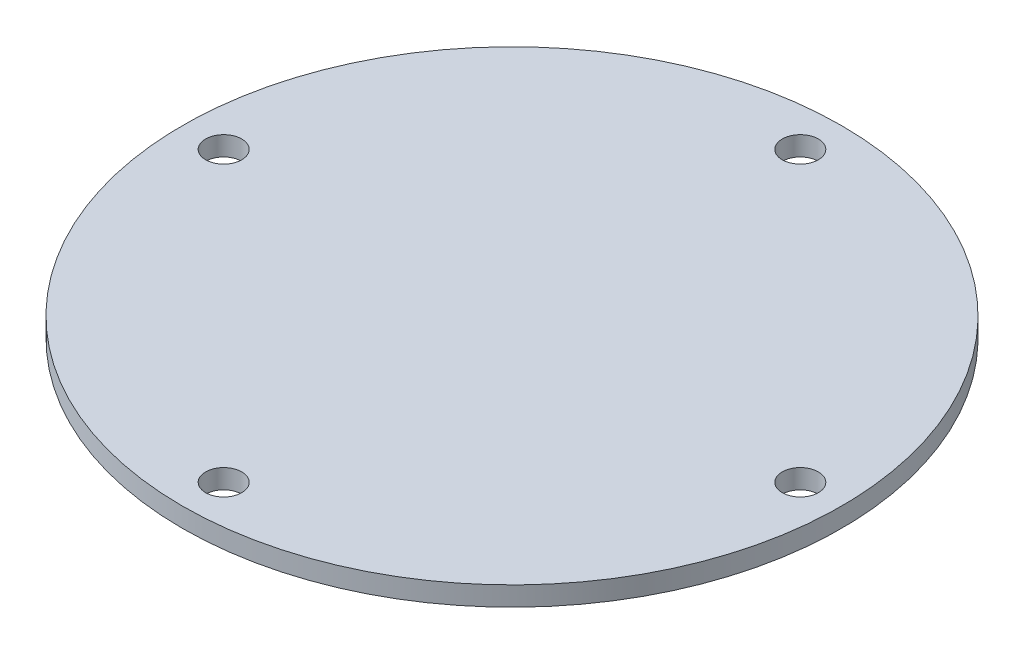
from build123d import *

# Parameters (mm, degrees)
SKETCH1_R            = 63.9
BOSS_EXTRUDE1_DEPTH  = 3.75
M6_CLEARANCE_HOLE1_D = 7
CIRPATTERN1_COUNT    = 4


with BuildPart() as part:
    # Sketch1 → Boss-Extrude1 (new body)
    with BuildSketch(Plane(origin=(0, 0, 0), x_dir=(1, 0, 0), z_dir=(0, 1, 0))):
        Circle(SKETCH1_R)
    extrude(amount=BOSS_EXTRUDE1_DEPTH)

    # M6 Clearance Hole1 (through all)
    with Locations(Plane(origin=(0, 3.75, 0), x_dir=(1, 0, 0), z_dir=(0, 1, 0))):
        with Locations((-55.9, 0)):
            m6_clearance_hole1 = Hole(M6_CLEARANCE_HOLE1_D / 2)

    # CirPattern1: M6 Clearance Hole1 ×4 about axis
    cirpattern1_axis = Axis((0, 3.75, 0), (0, -1, 0))
    for i in range(1, CIRPATTERN1_COUNT):
        add(m6_clearance_hole1.rotate(cirpattern1_axis, i * 360 / CIRPATTERN1_COUNT), mode=Mode.SUBTRACT)


solid = part.part
